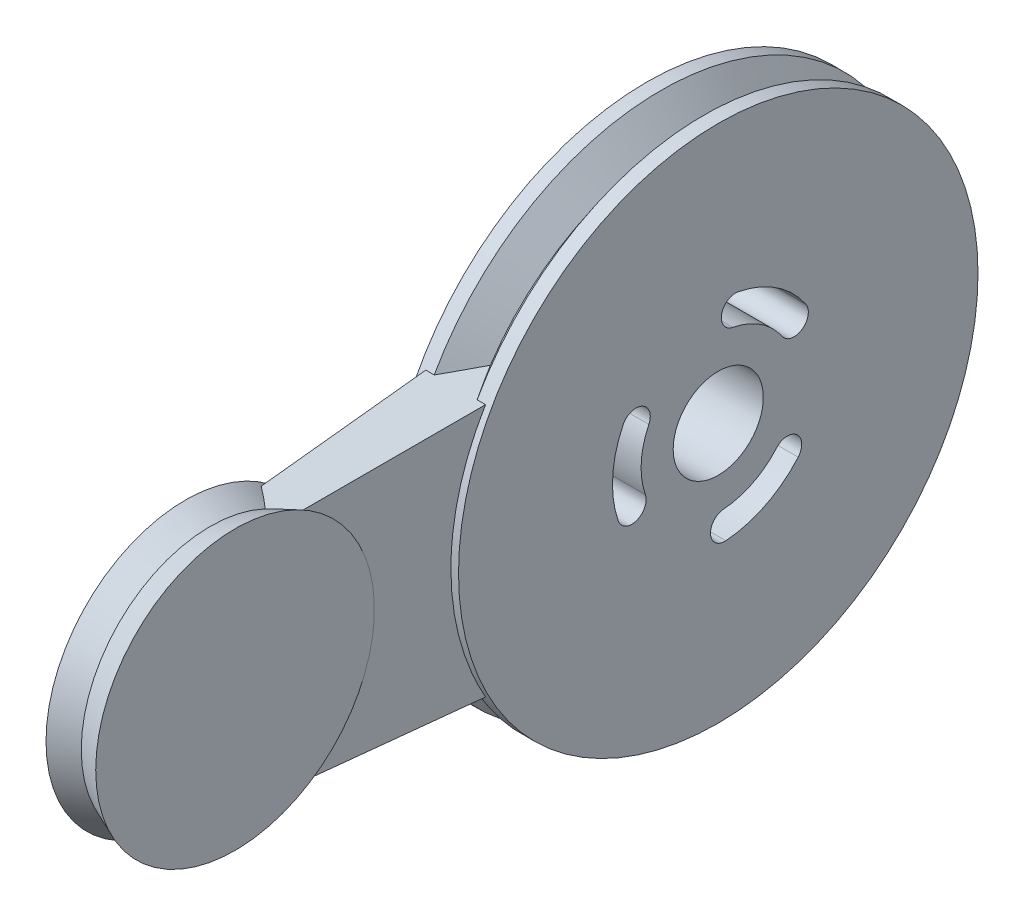
from build123d import *

# Parameters (mm, degrees)
CUT_EXTRUDE1_DEPTH      = 34.210352302
CUT_EXTRUDE1_DEPTH_BACK = 34.210352302
SKETCH4_W               = 6.35
SKETCH4_H               = 23.51410153
BOSS_EXTRUDE1_DEPTH     = 31.75
BOSS_EXTRUDE1_TAPER     = 3


with BuildPart() as part:
    # Sketch1 → Revolve1 (revolve)
    with BuildSketch(Plane.XY):
        Polygon((1.27, 23.05), (3.175, 20.51), (5.08, 23.05), (6.35, 23.05), (6.35, 4), (0, 4), (0, 23.05), align=None)
    revolve(axis=Axis((0, 0, 0), (1, 0, 0)))

    # Sketch2 → Cut-Extrude1 (cut, two sides: drawn at the far end of the back side and taken through both)
    with BuildSketch(Plane.ZY.offset(-CUT_EXTRUDE1_DEPTH_BACK)):
        with BuildLine():
            ThreePointArc((-5.174909182, -4.484253782), (-6.96638667, -4.356158459), (-7.094481993, -6.147635947))
            ThreePointArc((-7.094481993, -6.147635947), (-4.201848282, -8.394615744), (-0.66952126, -9.363591392))
            ThreePointArc((-0.66952126, -9.363591392), (0.687821691, -8.187402584), (-0.488367117, -6.830059633))
            ThreePointArc((-0.488367117, -6.830059633), (-3.064943047, -6.123262296), (-5.174909182, -4.484253782))
        make_face()
        with BuildLine():
            ThreePointArc((-1.296023101, 6.723729705), (-0.289350554, 8.211147058), (-1.776767907, 9.217819606))
            ThreePointArc((-1.776767907, 9.217819606), (-5.169026349, 7.836215227), (-7.774347386, 5.261618116))
            ThreePointArc((-7.774347386, 5.261618116), (-7.434409475, 3.498030234), (-5.670821593, 3.837968146))
            ThreePointArc((-5.670821593, 3.837968146), (-3.770429179, 5.715949688), (-1.296023101, 6.723729705))
        make_face()
        with BuildLine():
            ThreePointArc((6.470932284, -2.239475923), (7.255737223, -3.854988599), (8.871249899, -3.070183659))
            ThreePointArc((8.871249899, -3.070183659), (9.370874631, 0.558400517), (8.443868646, 4.101973277))
            ThreePointArc((8.443868646, 4.101973277), (6.746587783, 4.68937235), (6.15918871, 2.992091487))
            ThreePointArc((6.15918871, 2.992091487), (6.835372226, 0.407312608), (6.470932284, -2.239475923))
        make_face()
    extrude(amount=CUT_EXTRUDE1_DEPTH + CUT_EXTRUDE1_DEPTH_BACK, mode=Mode.SUBTRACT)

    # Sketch4 → Boss-Extrude1 (add)
    with BuildSketch(Plane.XY.offset(10.16)):
        with Locations((3.175, 0)):
            Rectangle(SKETCH4_W, SKETCH4_H)
    extrude(amount=BOSS_EXTRUDE1_DEPTH, taper=BOSS_EXTRUDE1_TAPER)

    # Sketch7 → Revolve2 (revolve)
    with BuildSketch(Plane.XY.offset(41.91)):
        Polygon((0.969681185, 0), (0.969681185, 12.366501989), (3.175, 11.443306753), (5.380318815, 12.366501989), (5.380318815, 0), align=None)
    revolve(axis=Axis((0, 0, 41.91), (1, 0, 0)))


solid = part.part
